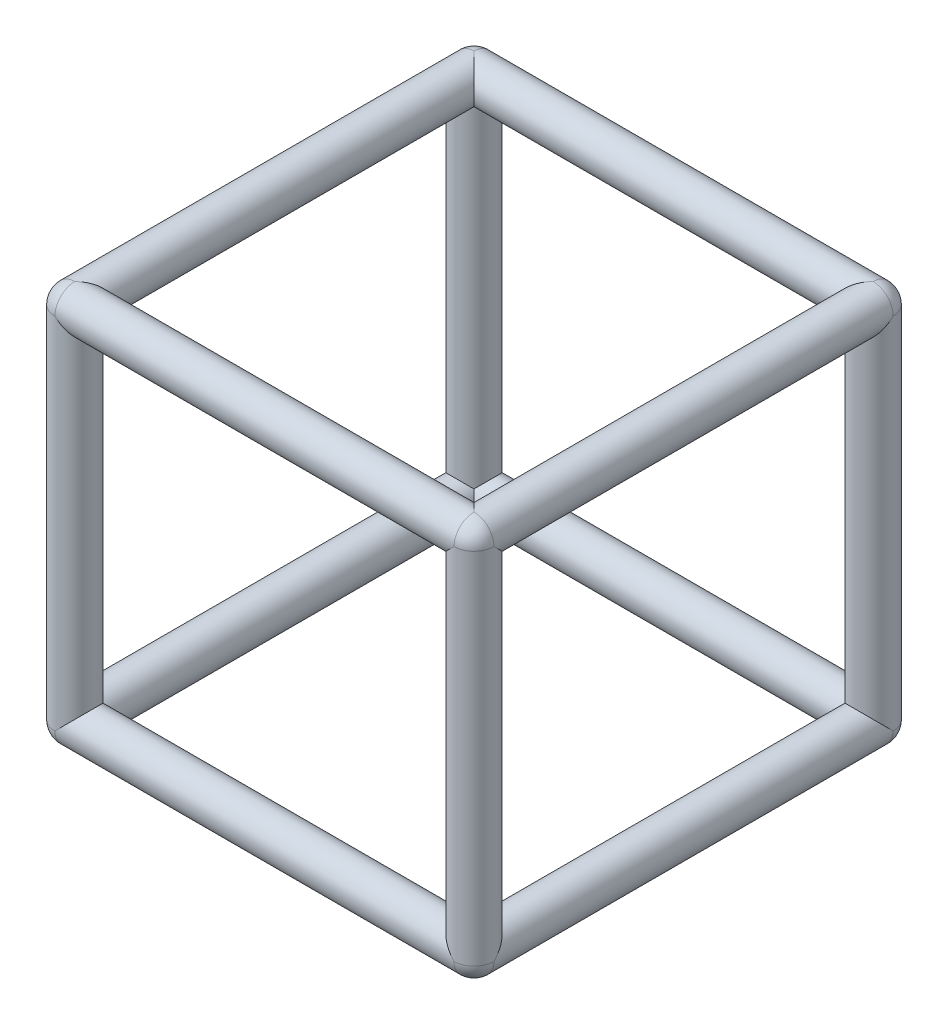
from build123d import *

# Parameters (mm, degrees)
SKETCH5_R            = 12.7
BOSS_EXTRUDE2_DEPTH  = 254
FILLET2_R            = 12.7
LPATTERN1_COUNT      = 2
LPATTERN1_PITCH      = 254
LPATTERN1_2_COUNT    = 2
LPATTERN1_2_PITCH    = 254
SKETCH6_R            = 12.7
BOSS_EXTRUDE3_DEPTH  = 127
LPATTERN2_COUNT      = 2
LPATTERN2_PITCH      = 254
LPATTERN2_COUNT_DIR2 = 2
LPATTERN2_PITCH_DIR2 = 228.6
SKETCH8_R            = 12.7
BOSS_EXTRUDE4_DEPTH  = 127
LPATTERN3_START      = -126.903037271
LPATTERN3_OUTLINE_R  = 12.7
LPATTERN3_DEPTH      = 253.805198296


# Read off the part's stored shape, not the designer's step: LPattern3
with BuildPart() as part:
    # Sketch5 → Boss-Extrude2 (new body)
    with BuildSketch(Plane(origin=(0, 0, 0), x_dir=(1, 0, 0), z_dir=(0, 1, 0))):
        with Locations(Location((-127, 127, 0), (0, 0, 270))):
            Circle(SKETCH5_R)
    extrude(amount=BOSS_EXTRUDE2_DEPTH)

    # Fillet2
    fillet2_edges = [part.edges().sort_by_distance(p)[0] for p in [
        (-127, 0, -139.7),
        (-127, 254, -139.7),
    ]]
    fillet(fillet2_edges, radius=FILLET2_R)


with BuildPart() as lpattern1_1:
    # LPattern1: pattern copy
    add(part.part.moved(Location(Vector(1, 0, 0) * (1 * LPATTERN1_PITCH))))


with BuildPart() as lpattern1_2_1:
    # LPattern1 2: pattern copy
    add(part.part.moved(Location(Vector(0, 0, 1) * (1 * LPATTERN1_2_PITCH))))



with BuildPart() as lpattern1_2_2:
    # LPattern1 2: pattern copy
    add(lpattern1_1.part.moved(Location(Vector(0, 0, 1) * (1 * LPATTERN1_2_PITCH))))


with BuildPart() as lpattern1_2_1_1:
    add(lpattern1_2_1.part)

    add(lpattern1_2_2.part)  # Boss-Extrude3 merges LPattern1 2_2
    # Sketch6 → Boss-Extrude3 (add, symmetric)
    with BuildSketch(Plane(origin=(0, 0, 0), x_dir=(0, 0, -1), z_dir=(1, 0, 0))):
        with Locations(Location((-127, 241.3, 0), (0, 0, 180))):
            Circle(SKETCH6_R)
    boss_extrude3 = extrude(amount=BOSS_EXTRUDE3_DEPTH, both=True)


with BuildPart() as part_1:
    add(part.part)

    add(lpattern1_1.part)  # LPattern2 merges LPattern1_1

    add(lpattern1_2_1_1.part)  # LPattern2 merges LPattern1 2_1
    # LPattern2: Boss-Extrude3 2 × 2
    with Locations(*[(0, -j * LPATTERN2_PITCH_DIR2, -i * LPATTERN2_PITCH) for i in range(LPATTERN2_COUNT) for j in range(LPATTERN2_COUNT_DIR2) if (i, j) != (0, 0)]):
        add(boss_extrude3)

    # Sketch8 → Boss-Extrude4 (add, symmetric)
    with BuildSketch(Plane.XY):
        with Locations(Location((-127, 241.3, 0), (0, 0, 180))):
            Circle(SKETCH8_R)
    extrude(amount=BOSS_EXTRUDE4_DEPTH, both=True)

    # LPattern3 outline → LPattern3 (add)
    with BuildSketch(Plane.XY.offset(LPATTERN3_START)):
        with Locations((127, 12.7)):
            Circle(LPATTERN3_OUTLINE_R)
        with Locations((-127, 12.7)):
            Circle(LPATTERN3_OUTLINE_R)
        with Locations((127, 241.3)):
            Circle(LPATTERN3_OUTLINE_R)
    extrude(amount=LPATTERN3_DEPTH)


solid = part_1.part
